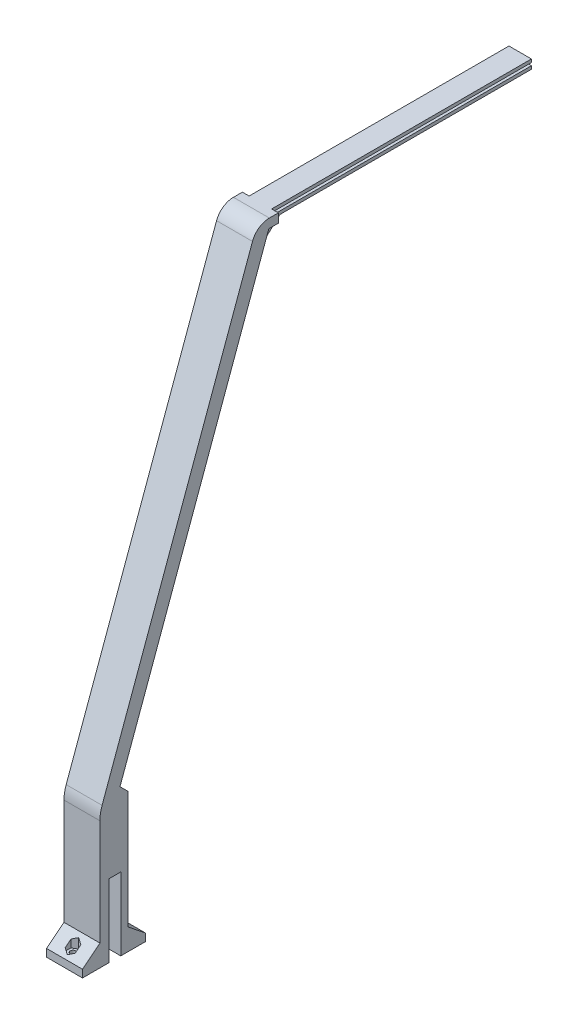
from build123d import *

# Parameters (mm, degrees)
BOSS_EXTRUDE1_DEPTH = 10
CHAMFER1_SIZE       = 7.802060087
CHAMFER1_SIZE_2     = 10
BOSS_EXTRUDE2_DEPTH = 20
SKETCH7_R           = 1.5
CUT_EXTRUDE1_DEPTH  = 20
CUT_EXTRUDE3_DEPTH  = 20
FILLET5_R           = 20
FILLET6_R           = 10
SKETCH10_W          = 5.3
SKETCH10_H          = 4.24
CUT_EXTRUDE4_DEPTH  = 273.805653344
SKETCH11_W          = 3.75
SKETCH11_H          = 144.691495626
CUT_EXTRUDE5_DEPTH  = 370.011076387
BOSS_EXTRUDE4_DEPTH = 12.5
SKETCH12_W          = 2
SKETCH12_H          = 1.5
CUT_EXTRUDE6_DEPTH  = 144.691496


with BuildPart() as part:
    # Sketch2 → Boss-Extrude1 (new, symmetric)
    with BuildSketch(Plane(origin=(0, 0, 0), x_dir=(0, 0, -1), z_dir=(1, 0, 0))):
        Polygon((36.072931518, 122.5), (-51.279924706, -117.5), (-51.279924706, -192), (-46.279924706, -192), (-46.279924706, -151.5), (-39.679924706, -151.5), (-39.679924706, -192), (-35.679924706, -192), (-35.679924706, -117.5), (-42.766502526, -117.5), (42.766502526, 117.5), (192.766502526, 117.5), (192.766502526, 122.5), align=None)
    extrude(amount=BOSS_EXTRUDE1_DEPTH, both=True)

    # Chamfer1
    # the kernel refuses this chamfer: 10, 7.802060087 mm, written as the material it adds along each edge
    with BuildSketch(Plane(origin=(-10, -117.5, 42.766502526), x_dir=(0, 0.9542611885293297, -0.298974219735734), z_dir=(1, 0, 0))) as chamfer1_piece_1_section:
        Polygon((CHAMFER1_SIZE * 0.998967402661, -CHAMFER1_SIZE * 0.0454326803806), (CHAMFER1_SIZE_2 * 0.298974219736, -CHAMFER1_SIZE_2 * 0.954261188529), (0, 0), align=None)
    chamfer1_piece_1 = extrude(amount=20, mode=Mode.PRIVATE)
    chamfer1_piece_1 = split(chamfer1_piece_1, bisect_by=Plane(origin=(0, -114.855220314, 35.679924706), z_dir=(0, 0, 1)), keep=Keep.TOP, mode=Mode.PRIVATE)
    add(chamfer1_piece_1)

    # Sketch6 → Boss-Extrude2 (add)
    with BuildSketch(Plane(origin=(10, 0, 0), x_dir=(0, 0, -1), z_dir=(1, 0, 0))):
        Polygon((-51.279924706, -180), (-66.279924706, -192), (-51.279924706, -192), align=None)
        Polygon((-35.679924706, -192), (-20.679924706, -192), (-35.679924706, -180), align=None)
    extrude(amount=-BOSS_EXTRUDE2_DEPTH)

    # Sketch7 → Cut-Extrude1 (cut)
    with BuildSketch(Plane(origin=(0, -192, 0), x_dir=(-1, 0, 0), z_dir=(0, -1, 0))):
        with Locations(Location((0, -56.279924706, 0), (0, 0, 90))):
            Circle(SKETCH7_R)
        with Locations(Location((0, -30.179924706, 0), (0, 0, 90))):
            Circle(SKETCH7_R)
    extrude(amount=-CUT_EXTRUDE1_DEPTH, mode=Mode.SUBTRACT)

    # Sketch9 → Cut-Extrude3 (cut)
    with BuildSketch(Plane(origin=(0, -187, 0), x_dir=(-1, 0, 0), z_dir=(0, -1, 0))):
        Polygon((2.75, -57.867637946), (2.75, -54.692211466), (0, -53.104498226), (-2.75, -54.692211466), (-2.75, -57.867637946), (0, -59.455351187), align=None)
        Polygon((2.75, -31.767637946), (2.75, -28.592211466), (0, -27.004498226), (-2.75, -28.592211466), (-2.75, -31.767637946), (0, -33.355351187), align=None)
    extrude(amount=-CUT_EXTRUDE3_DEPTH, mode=Mode.SUBTRACT)

    # Fillet5
    fillet5_edges = [part.edges().sort_by_distance(p)[0] for p in [
        (0, -117.5, 51.279924706),
    ]]
    fillet(fillet5_edges, radius=FILLET5_R)

    # Fillet6
    fillet6_edges = [part.edges().sort_by_distance(p)[0] for p in [
        (0, 122.5, -36.072931518),
    ]]
    fillet(fillet6_edges, radius=FILLET6_R)

    # Sketch10 → Cut-Extrude4 (cut, through all)
    with BuildSketch(Plane(origin=(10, 0, 0), x_dir=(0, 0, -1), z_dir=(1, 0, 0))):
        with Locations((-63.629924706, -189.88)):
            Rectangle(SKETCH10_W, SKETCH10_H)
        with Locations((-23.329924706, -189.88)):
            Rectangle(SKETCH10_W, SKETCH10_H)
    extrude(amount=-CUT_EXTRUDE4_DEPTH, mode=Mode.SUBTRACT)

    # Sketch11 → Cut-Extrude5 (cut, through all)
    with BuildSketch(Plane(origin=(0, 122.5, 0), x_dir=(1, 0, 0), z_dir=(0, 1, 0))):
        with Locations((-8.125, 120.420754713)):
            Rectangle(SKETCH11_W, SKETCH11_H)
        with Locations((8.125, 120.420754713)):
            Rectangle(SKETCH11_W, SKETCH11_H)
    extrude(amount=-CUT_EXTRUDE5_DEPTH, mode=Mode.SUBTRACT)

    # Sketch13 → Boss-Extrude4 (add)
    with BuildSketch(Plane(origin=(6.25, 0, 0), x_dir=(0, 0, -1), z_dir=(1, 0, 0))):
        Polygon((52.766502526, 117.5), (37.766502526, 103.762612903), (42.766502526, 117.5), align=None)
    extrude(amount=-BOSS_EXTRUDE4_DEPTH)

    # Sketch12 → Cut-Extrude6 (cut)
    with BuildSketch(Plane(origin=(0, 0, -192.766502526), x_dir=(-1, 0, 0), z_dir=(0, 0, -1))):
        with Locations((-5.25, 120)):
            Rectangle(SKETCH12_W, SKETCH12_H)
        with Locations((5.25, 120)):
            Rectangle(SKETCH12_W, SKETCH12_H)
    extrude(amount=-CUT_EXTRUDE6_DEPTH, mode=Mode.SUBTRACT)


solid = part.part
